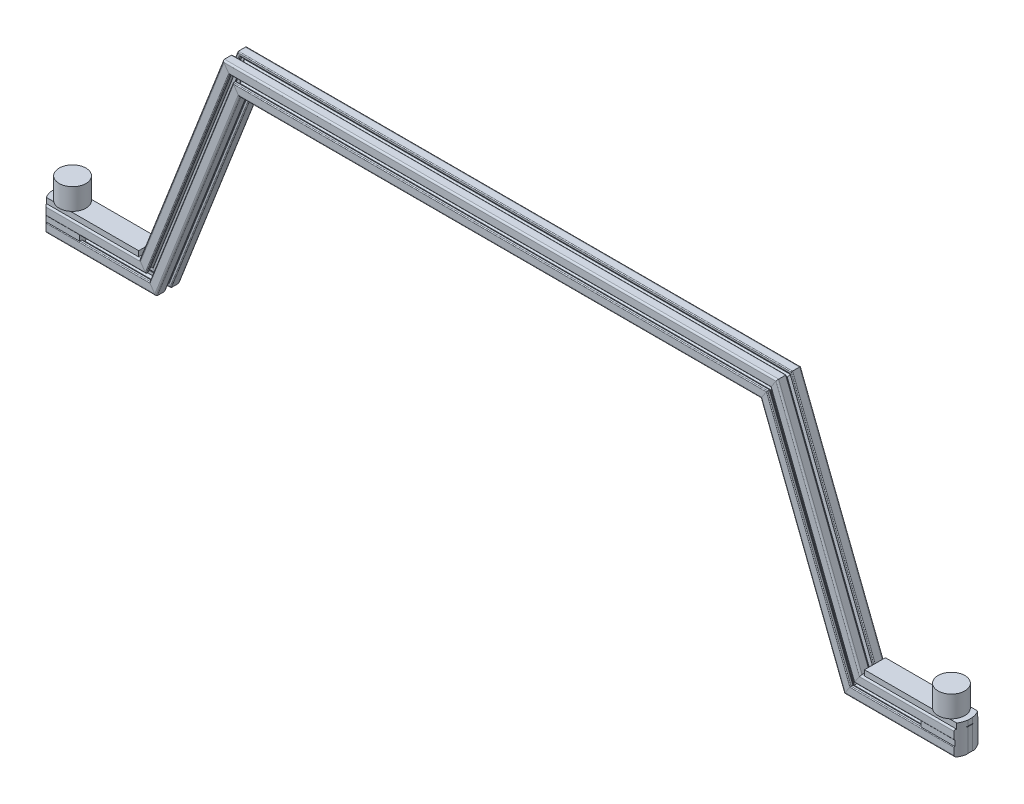
from build123d import *

# Parameters (mm, degrees)
SKETCH3_W            = 177.95649801978897
SKETCH3_H            = 38.99999999999999
BOSS_EXTRUDE1_DEPTH  = 10
SKETCH4_R            = 25.000000000000004
FL_WHEEL_MOUNT_DEPTH = 40
BOSS_EXTRUDE3_DEPTH  = 70
CUT_EXTRUDE1_REACH   = 943.011


with BuildPart() as part:
    # Sweep1: sweep along a path in Sketch1
    with BuildLine(Plane.XY) as sweep1_path:
        Line((0, 0), (200, 0))
        Line((200, 0), (355.8974358974359, 400))
        Line((355.8974358974359, 400), (855.8974358974358, 400))
    # Sketch7 → Sweep1 (sweep)
    with BuildSketch(Plane(origin=(0, 0, 0), x_dir=(0, 0, -1), z_dir=(1, 0, 0))):
        with BuildLine():
            Line((4.905816029016867, 11.21531925961758), (4.005816102684597, 10.70017121598502))
            Line((4.005816102684597, 10.70017121598502), (3.105816176352211, 11.21531925961758))
            Line((3.105816176352211, 11.21531925961758), (-2.1975082146962652, 11.215319259617562))
            ThreePointArc((-2.1975082146962652, 11.215319259617562), (-2.3429279189949894, 11.244245037263257), (-2.4662087915471362, 11.326618682766647))
            Line((-2.4662087915471362, 11.326618682766647), (-5.932884474166096, 14.79329436538555))
            ThreePointArc((-5.932884474166096, 14.79329436538555), (-6.015258119669531, 14.9165752379377), (-6.044183897315248, 15.06199494223645))
            Line((-6.044183897315248, 15.06199494223645), (-6.044183897315358, 19.35531925961757))
            ThreePointArc((-6.044183897315358, 19.35531925961757), (-5.93288447416625, 19.62401983646846), (-5.664183897315362, 19.73531925961757))
            Line((-5.664183897315362, 19.73531925961757), (-2.5791838973153265, 19.73531925961757))
            ThreePointArc((-2.5791838973153265, 19.73531925961757), (-1.5043815899117716, 20.180516952214003), (-1.0591838973153256, 21.25531925961755))
            Line((-1.0591838973153256, 21.25531925961755), (-1.059183897315572, 24.21531925961759))
            ThreePointArc((-1.059183897315572, 24.21531925961759), (-1.504381589912015, 25.290121567021124), (-2.579183897315554, 25.73531925961756))
            Line((-2.579183897315554, 25.73531925961756), (-15.4941838973154, 25.73531925961757))
            ThreePointArc((-15.4941838973154, 25.73531925961757), (-17.61550424087504, 24.85663960317721), (-18.4941838973154, 22.735319259617572))
            Line((-18.4941838973154, 22.735319259617572), (-18.4941838973154, 9.820319259617662))
            ThreePointArc((-18.4941838973154, 9.820319259617662), (-18.048986204718968, 8.745516952214107), (-16.97418389731542, 8.300319259617662))
            Line((-16.97418389731542, 8.300319259617662), (-14.014183897315382, 8.300319259617766))
            ThreePointArc((-14.014183897315382, 8.300319259617766), (-12.939381589911845, 8.745516952214206), (-12.494183897315379, 9.820319259617733))
            Line((-12.494183897315379, 9.820319259617733), (-12.4941838973154, 12.90531925961758))
            ThreePointArc((-12.4941838973154, 12.90531925961758), (-12.382884474166298, 13.17401983646847), (-12.11418389731541, 13.285319259617582))
            Line((-12.11418389731541, 13.285319259617582), (-7.81378851212248, 13.28531925961746))
            ThreePointArc((-7.81378851212248, 13.28531925961746), (-7.668368807823728, 13.256393481971749), (-7.545087935271565, 13.17401983646833))
            Line((-7.545087935271565, 13.17401983646833), (-4.08548332046457, 9.714415221661511))
            ThreePointArc((-4.08548332046457, 9.714415221661511), (-4.003109674961121, 9.591134349109351), (-3.974183897315418, 9.445714644810582))
            Line((-3.974183897315418, 9.445714644810582), (-3.9741838973154215, 4.135318894911249))
            Line((-3.9741838973154215, 4.135318894911249), (-3.454570627598921, 3.235319259617511))
            Line((-3.454570627598921, 3.235319259617511), (-3.9741838973154215, 2.335319624323374))
            Line((-3.9741838973154215, 2.335319624323374), (-3.9741838973154215, -2.968005057763236))
            ThreePointArc((-3.9741838973154215, -2.968005057763236), (-4.003109674961133, -3.1134247620619817), (-4.0854833204645455, -3.236705634614141))
            Line((-4.0854833204645455, -3.236705634614141), (-7.55215900308344, -6.703381317233124))
            ThreePointArc((-7.55215900308344, -6.703381317233124), (-7.675439875635574, -6.785754962736517), (-7.820859579934288, -6.81468074038222))
            Line((-7.820859579934288, -6.81468074038222), (-12.11418389731541, -6.814680740382358))
            ThreePointArc((-12.11418389731541, -6.814680740382358), (-12.382884474166277, -6.703381317233245), (-12.494183897315413, -6.4346807403823885))
            Line((-12.494183897315413, -6.4346807403823885), (-12.4941838973154, -3.349680740382297))
            ThreePointArc((-12.4941838973154, -3.349680740382297), (-12.939381589911832, -2.274878432978741), (-14.014183897315382, -1.8296807403822957))
            Line((-14.014183897315382, -1.8296807403822957), (-16.97418389731542, -1.829680740382543))
            ThreePointArc((-16.97418389731542, -1.829680740382543), (-18.04898620471899, -2.2748784329789906), (-18.49418389731542, -3.349680740382567))
            Line((-18.49418389731542, -3.349680740382567), (-18.4941838973154, -16.26468074038243))
            ThreePointArc((-18.4941838973154, -16.26468074038243), (-17.615504240875044, -18.386001083942077), (-15.4941838973154, -19.264680740382435))
            Line((-15.4941838973154, -19.264680740382435), (-2.57918389731544, -19.26468074038243))
            ThreePointArc((-2.57918389731544, -19.26468074038243), (-1.5043815899118904, -18.819483047785972), (-1.059183897315442, -17.74468074038242))
            Line((-1.059183897315442, -17.74468074038242), (-1.059183897315572, -14.78468074038241))
            ThreePointArc((-1.059183897315572, -14.78468074038241), (-1.5043815899120052, -13.709878432978856), (-2.579183897315554, -13.264680740382412))
            Line((-2.579183897315554, -13.264680740382412), (-5.664183897315362, -13.26468074038243))
            ThreePointArc((-5.664183897315362, -13.26468074038243), (-5.932884474166251, -13.15338131723332), (-6.044183897315363, -12.884680740382432))
            Line((-6.044183897315363, -12.884680740382432), (-6.044183897315244, -8.58428535518951))
            ThreePointArc((-6.044183897315244, -8.58428535518951), (-6.015258119669534, -8.438865650890763), (-5.932884474166121, -8.315584778338604))
            Line((-5.932884474166121, -8.315584778338604), (-2.473279859359261, -4.85598016353157))
            ThreePointArc((-2.473279859359261, -4.85598016353157), (-2.3499989868071354, -4.77360651802815), (-2.204579282508414, -4.744680740382445))
            Line((-2.204579282508414, -4.744680740382445), (3.105816176352211, -4.74468074038245))
            Line((3.105816176352211, -4.74468074038245), (4.005816102684597, -4.229532696749942))
            Line((4.005816102684597, -4.229532696749942), (4.9058160290169806, -4.74468074038245))
            Line((4.9058160290169806, -4.74468074038245), (10.20914042006546, -4.744680740382422))
            ThreePointArc((10.20914042006546, -4.744680740382422), (10.354560124364177, -4.773606518028121), (10.47784099691632, -4.855980163531502))
            Line((10.47784099691632, -4.855980163531502), (13.944516679535292, -8.322655846150411))
            ThreePointArc((13.944516679535292, -8.322655846150411), (14.02689032503872, -8.445936718702562), (14.05581610268444, -8.591356423001304))
            Line((14.05581610268444, -8.591356423001304), (14.05581610268455, -12.884680740382432))
            ThreePointArc((14.05581610268455, -12.884680740382432), (13.944516679535438, -13.153381317233318), (13.67581610268455, -13.26468074038243))
            Line((13.67581610268455, -13.26468074038243), (10.59081610268452, -13.26468074038243))
            ThreePointArc((10.59081610268452, -13.26468074038243), (9.516013795280966, -13.70987843297886), (9.070816102684521, -14.78468074038241))
            Line((9.070816102684521, -14.78468074038241), (9.070816102684764, -17.74468074038245))
            ThreePointArc((9.070816102684764, -17.74468074038245), (9.5160137952812, -18.819483047785987), (10.59081610268474, -19.264680740382424))
            Line((10.59081610268474, -19.264680740382424), (23.50581610268459, -19.26468074038243))
            ThreePointArc((23.50581610268459, -19.26468074038243), (25.627136446244233, -18.386001083942073), (26.50581610268459, -16.26468074038243))
            Line((26.50581610268459, -16.26468074038243), (26.50581610268448, -3.349680740382411))
            ThreePointArc((26.50581610268448, -3.349680740382411), (26.060618410088097, -2.2748784329789036), (24.985816102684634, -1.8296807403824098))
            Line((24.985816102684634, -1.8296807403824098), (22.02581610268446, -1.829680740382515))
            ThreePointArc((22.02581610268446, -1.829680740382515), (20.951013795280893, -2.2748784329789853), (20.50581610268446, -3.349680740382567))
            Line((20.50581610268446, -3.349680740382567), (20.50581610268448, -6.434680740382334))
            ThreePointArc((20.50581610268448, -6.434680740382334), (20.394516679535418, -6.703381317233182), (20.125816102684606, -6.814680740382337))
            Line((20.125816102684606, -6.814680740382337), (15.825420717491562, -6.814680740382217))
            ThreePointArc((15.825420717491562, -6.814680740382217), (15.680001013192856, -6.7857549627365215), (15.556720140640715, -6.703381317233152))
            Line((15.556720140640715, -6.703381317233152), (12.09711552583365, -3.24377670242626))
            ThreePointArc((12.09711552583365, -3.24377670242626), (12.014741880330227, -3.120495829874147), (11.985816102684492, -2.975076125575442))
            Line((11.985816102684492, -2.975076125575442), (11.9858161026845, 2.335319624323545))
            Line((11.9858161026845, 2.335319624323545), (11.46620283296811, 3.235319259617624))
            Line((11.46620283296811, 3.235319259617624), (11.98581610268461, 4.135318894911704))
            Line((11.98581610268461, 4.135318894911704), (11.98581610268461, 9.438643576998516))
            ThreePointArc((11.98581610268461, 9.438643576998516), (12.014741880330329, 9.584063281297267), (12.097115525833749, 9.70734415384943))
            Line((12.097115525833749, 9.70734415384943), (15.563791208452631, 13.174019836468371))
            ThreePointArc((15.563791208452631, 13.174019836468371), (15.687072081004764, 13.256393481971767), (15.832491785303478, 13.28531925961747))
            Line((15.832491785303478, 13.28531925961747), (20.1258161026846, 13.28531925961761))
            ThreePointArc((20.1258161026846, 13.28531925961761), (20.394516679535503, 13.174019836468457), (20.5058161026846, 12.905319259617526))
            Line((20.5058161026846, 12.905319259617526), (20.50581610268459, 9.820319259617548))
            ThreePointArc((20.50581610268459, 9.820319259617548), (20.951013795281032, 8.745516952213997), (22.02581610268458, 8.300319259617549))
            Line((22.02581610268458, 8.300319259617549), (24.98581610268461, 8.300319259617792))
            ThreePointArc((24.98581610268461, 8.300319259617792), (26.06061841008815, 8.74551695221421), (26.50581610268461, 9.820319259617733))
            Line((26.50581610268461, 9.820319259617733), (26.5058161026846, 22.735319259617572))
            ThreePointArc((26.5058161026846, 22.735319259617572), (25.627136446244233, 24.85663960317721), (23.50581610268459, 25.73531925961757))
            Line((23.50581610268459, 25.73531925961757), (10.59081610268463, 25.73531925961757))
            ThreePointArc((10.59081610268463, 25.73531925961757), (9.51601379528108, 25.29012156702114), (9.070816102684635, 24.21531925961759))
            Line((9.070816102684635, 24.21531925961759), (9.070816102684764, 21.25531925961758))
            ThreePointArc((9.070816102684764, 21.25531925961758), (9.51601379528119, 20.18051695221402), (10.59081610268474, 19.735319259617576))
            Line((10.59081610268474, 19.735319259617576), (13.67581610268455, 19.73531925961757))
            ThreePointArc((13.67581610268455, 19.73531925961757), (13.944516679535438, 19.624019836468456), (14.055816102684554, 19.35531925961757))
            Line((14.055816102684554, 19.35531925961757), (14.055816102684432, 15.05492387442464))
            ThreePointArc((14.055816102684432, 15.05492387442464), (14.026890325038721, 14.909504170125889), (13.944516679535301, 14.786223297573725))
            Line((13.944516679535301, 14.786223297573725), (10.484912064728451, 11.326618682766702))
            ThreePointArc((10.484912064728451, 11.326618682766702), (10.361631192176315, 11.244245037263312), (10.2162114878776, 11.215319259617608))
            Line((10.2162114878776, 11.215319259617608), (4.905816029016867, 11.21531925961758))
        make_face()
        with BuildLine():
            Line((13.969837884314126, 21.274341041247055), (13.529837884314462, 21.274341041247))
            ThreePointArc((13.529837884314462, 21.274341041247), (12.46917771253464, 21.713680869467176), (12.02983788431446, 22.774341041247))
            Line((12.02983788431446, 22.774341041247), (12.02983788431446, 23.27434104124714))
            ThreePointArc((12.02983788431446, 23.27434104124714), (12.469177712534641, 24.335001213026963), (13.529837884314462, 24.77434104124714))
            Line((13.529837884314462, 24.77434104124714), (23.1398378843142, 24.77434104124711))
            ThreePointArc((23.1398378843142, 24.77434104124711), (24.752041345419528, 24.10654450235244), (25.4198378843142, 22.49434104124711))
            Line((25.4198378843142, 22.49434104124711), (25.41983788431417, 12.8843410412473))
            ThreePointArc((25.41983788431417, 12.8843410412473), (24.98049805609399, 11.823680869467479), (23.91983788431417, 11.384341041247298))
            Line((23.91983788431417, 11.384341041247298), (23.41983788431416, 11.38434104124724))
            ThreePointArc((23.41983788431416, 11.38434104124724), (22.359177712534358, 11.823680869467406), (21.919837884314166, 12.884341041247197))
            Line((21.919837884314166, 12.884341041247197), (21.919837884314173, 13.32434104124721))
            ThreePointArc((21.919837884314173, 13.32434104124721), (21.62694466550073, 14.031447822433739), (20.919837884314216, 14.32434104124721))
            Line((20.919837884314216, 14.32434104124721), (15.34983788431423, 14.324341041247353))
            ThreePointArc((15.34983788431423, 14.324341041247353), (15.08113730746334, 14.435640464396453), (14.969837884314229, 14.70434104124734))
            Line((14.969837884314229, 14.70434104124734), (14.96983788431424, 20.27434104124706))
            ThreePointArc((14.96983788431424, 20.27434104124706), (14.676944665500747, 20.981447822433648), (13.969837884314126, 21.274341041247055))
        make_face(mode=Mode.SUBTRACT)
        with BuildLine():
            Line((21.95885966594362, -6.689680740382415), (21.95885966594362, -6.249680740382729))
            ThreePointArc((21.95885966594362, -6.249680740382729), (22.398199494163798, -5.189020568602908), (23.45885966594362, -4.74968074038273))
            Line((23.45885966594362, -4.74968074038273), (23.958859665943745, -4.749680740382729))
            ThreePointArc((23.958859665943745, -4.749680740382729), (25.01951983772356, -5.189020568602912), (25.458859665943738, -6.249680740382729))
            Line((25.458859665943738, -6.249680740382729), (25.45885966594368, -15.859680740382462))
            ThreePointArc((25.45885966594368, -15.859680740382462), (24.791063127048982, -17.471884201487782), (23.17885966594365, -18.13968074038246))
            Line((23.17885966594365, -18.13968074038246), (13.56885966594387, -18.13968074038243))
            ThreePointArc((13.56885966594387, -18.13968074038243), (12.50819949416405, -17.70034091216225), (12.068859665943872, -16.63968074038243))
            Line((12.068859665943872, -16.63968074038243), (12.06885966594381, -16.13968074038244))
            ThreePointArc((12.06885966594381, -16.13968074038244), (12.508199494163975, -15.079020568602633), (13.568859665943767, -14.63968074038244))
            Line((13.568859665943767, -14.63968074038244), (14.008859665943811, -14.63968074038243))
            ThreePointArc((14.008859665943811, -14.63968074038243), (14.715966447130349, -14.346787521568986), (15.008859665943808, -13.639680740382458))
            Line((15.008859665943808, -13.639680740382458), (15.00885966594392, -8.069680740382497))
            ThreePointArc((15.00885966594392, -8.069680740382497), (15.120159089093024, -7.800980163531606), (15.38885966594391, -7.689680740382494))
            Line((15.38885966594391, -7.689680740382494), (20.95885966594362, -7.6896807403825))
            ThreePointArc((20.95885966594362, -7.6896807403825), (21.6659664471302, -7.396787521569017), (21.95885966594362, -6.689680740382415))
        make_face(mode=Mode.SUBTRACT)
        with BuildLine():
            Line((-6.005162115685757, -14.678702522011942), (-5.565162115686073, -14.67870252201189))
            ThreePointArc((-5.565162115686073, -14.67870252201189), (-4.504501943906252, -15.118042350232068), (-4.065162115686071, -16.17870252201189))
            Line((-4.065162115686071, -16.17870252201189), (-4.065162115686073, -16.67870252201203))
            ThreePointArc((-4.065162115686073, -16.67870252201203), (-4.504501943906252, -17.739362693791854), (-5.565162115686073, -18.17870252201203))
            Line((-5.565162115686073, -18.17870252201203), (-15.175162115685803, -18.178702522012))
            ThreePointArc((-15.175162115685803, -18.178702522012), (-16.787365576791128, -17.510905983117325), (-17.4551621156858, -15.898702522012))
            Line((-17.4551621156858, -15.898702522012), (-17.4551621156858, -6.288702522012187))
            ThreePointArc((-17.4551621156858, -6.288702522012187), (-17.01582228746562, -5.228042350232365), (-15.9551621156858, -4.788702522012187))
            Line((-15.9551621156858, -4.788702522012187), (-15.45516211568583, -4.788702522012131))
            ThreePointArc((-15.45516211568583, -4.788702522012131), (-14.394501943906025, -5.228042350232296), (-13.95516211568583, -6.2887025220120885))
            Line((-13.95516211568583, -6.2887025220120885), (-13.9551621156858, -6.7287025220121))
            ThreePointArc((-13.9551621156858, -6.7287025220121), (-13.662268896872359, -7.4358093031986385), (-12.955162115685829, -7.728702522012101))
            Line((-12.955162115685829, -7.728702522012101), (-7.385162115685895, -7.7287025220122425))
            ThreePointArc((-7.385162115685895, -7.7287025220122425), (-7.116461538835007, -7.84000194516135), (-7.005162115685896, -8.108702522012237))
            Line((-7.005162115685896, -8.108702522012237), (-7.005162115685843, -13.67870252201194))
            ThreePointArc((-7.005162115685843, -13.67870252201194), (-6.71226889687236, -14.385809303198519), (-6.005162115685757, -14.678702522011942))
        make_face(mode=Mode.SUBTRACT)
        with BuildLine():
            Line((1.828915921783154, -2.488564033794063), (1.413170132153103, -2.3163564892297765))
            ThreePointArc((1.413170132153103, -2.3163564892297765), (0.8233361546720646, -1.6253071256103948), (1.0362699251979821, -0.7420673205067814))
            ThreePointArc((1.0362699251979821, -0.7420673205067814), (0.44670320424367826, -0.23761386930494943), (-0.05771663654724213, 0.351981608207141))
            ThreePointArc((-0.05771663654724213, 0.351981608207141), (-0.9409371706461417, 0.13910189708009613), (-1.6319522534634663, 0.7289276667633529))
            Line((-1.6319522534634663, 0.7289276667633529), (-1.8041597980277773, 1.144673456393433))
            ThreePointArc((-1.8041597980277773, 1.144673456393433), (-1.7325897121288976, 2.0503947527944133), (-0.957477943443773, 2.5243726953145917))
            ThreePointArc((-0.957477943443773, 2.5243726953145917), (-1.0176621136546347, 3.2979617778010164), (-0.9574338433371404, 4.071547428094972))
            ThreePointArc((-0.9574338433371404, 4.071547428094972), (-1.7324937595966465, 4.545549969724606), (-1.804045409097357, 5.451241222148561))
            Line((-1.804045409097357, 5.451241222148561), (-1.6318378645330658, 5.866987011778611))
            ThreePointArc((-1.6318378645330658, 5.866987011778611), (-0.940788500913663, 6.456820989259641), (-0.05754869581003179, 6.243887218733747))
            ThreePointArc((-0.05754869581003179, 6.243887218733747), (0.4469047553918468, 6.833453939687905), (1.0365002329039577, 7.337873780478677))
            ThreePointArc((1.0365002329039577, 7.337873780478677), (0.8236205217769148, 8.221094314577591), (1.4134462914601942, 8.912109397394914))
            Line((1.4134462914601942, 8.912109397394914), (1.8291920810902504, 9.084316941959186))
            ThreePointArc((1.8291920810902504, 9.084316941959186), (2.734913377491232, 9.012746856060335), (3.208891320011409, 8.23763508737521))
            ThreePointArc((3.208891320011409, 8.23763508737521), (3.982480402497697, 8.297819257585996), (4.7560660527915095, 8.237590987268506))
            ThreePointArc((4.7560660527915095, 8.237590987268506), (5.230068594421157, 9.01265090352799), (6.135759846845102, 9.084202553028694))
            Line((6.135759846845102, 9.084202553028694), (6.551505636475179, 8.911995008464404))
            ThreePointArc((6.551505636475179, 8.911995008464404), (7.141339613955897, 8.220945644845237), (6.928405843430371, 7.337705839741907))
            ThreePointArc((6.928405843430371, 7.337705839741907), (7.517972564384662, 6.83325238854008), (8.022392405175577, 6.243656911027995))
            ThreePointArc((8.022392405175577, 6.243656911027995), (8.90561293927449, 6.456536622155043), (9.59662802209183, 5.866710852471783))
            Line((9.59662802209183, 5.866710852471783), (9.768835566656085, 5.450965062841702))
            ThreePointArc((9.768835566656085, 5.450965062841702), (9.697265480757252, 4.545243766440708), (8.922153712072108, 4.071265823920541))
            ThreePointArc((8.922153712072108, 4.071265823920541), (8.982337882282934, 3.2976767414341053), (8.922109611965613, 2.5240910911401406))
            ThreePointArc((8.922109611965613, 2.5240910911401406), (9.697169528224983, 2.050088549510487), (9.76872117772571, 1.1443972970866416))
            Line((9.76872117772571, 1.1443972970866416), (9.596513633161447, 0.7286515074565642))
            ThreePointArc((9.596513633161447, 0.7286515074565642), (8.905464269542016, 0.13881752997559105), (8.022224464438398, 0.3517513005014714))
            ThreePointArc((8.022224464438398, 0.3517513005014714), (7.517771013236633, -0.23781542045279824), (6.928175535724686, -0.7422352612437741))
            ThreePointArc((6.928175535724686, -0.7422352612437741), (7.14105524685153, -1.6254557953426318), (6.551229477168359, -2.3164708781599113))
            Line((6.551229477168359, -2.3164708781599113), (6.1354836875382786, -2.4886784227241967))
            ThreePointArc((6.1354836875382786, -2.4886784227241967), (5.229762391137301, -2.4171083368253283), (4.755784448617146, -1.641996568140192))
            ThreePointArc((4.755784448617146, -1.641996568140192), (3.982195366130722, -1.7021807383512026), (3.2086097158367415, -1.6419524680338808))
            ThreePointArc((3.2086097158367415, -1.6419524680338808), (2.734607174207096, -2.4170123842933635), (1.828915921783154, -2.488564033794063))
        make_face(mode=Mode.SUBTRACT)
        with BuildLine():
            Line((-13.99418389731535, 13.285319259617525), (-13.99418389731529, 12.84531925961784))
            ThreePointArc((-13.99418389731529, 12.84531925961784), (-14.43352372553547, 11.784659087838019), (-15.49418389731529, 11.34531925961784))
            Line((-15.49418389731529, 11.34531925961784), (-15.994183897315432, 11.34531925961784))
            ThreePointArc((-15.994183897315432, 11.34531925961784), (-17.05484406909525, 11.78465908783802), (-17.49418389731543, 12.84531925961784))
            Line((-17.49418389731543, 12.84531925961784), (-17.4941838973154, 22.45531925961757))
            ThreePointArc((-17.4941838973154, 22.45531925961757), (-16.826387358420728, 24.0675227207229), (-15.2141838973154, 24.735319259617572))
            Line((-15.2141838973154, 24.735319259617572), (-5.604183897315587, 24.73531925961757))
            ThreePointArc((-5.604183897315587, 24.73531925961757), (-4.543523725535764, 24.29597943139739), (-4.104183897315586, 23.23531925961757))
            Line((-4.104183897315586, 23.23531925961757), (-4.104183897315531, 22.735319259617572))
            ThreePointArc((-4.104183897315531, 22.735319259617572), (-4.543523725535693, 21.674659087837767), (-5.604183897315486, 21.235319259617572))
            Line((-5.604183897315486, 21.235319259617572), (-6.0441838973155, 21.23531925961757))
            ThreePointArc((-6.0441838973155, 21.23531925961757), (-6.751290678502038, 20.942426040804126), (-7.0441838973155, 20.235319259617597))
            Line((-7.0441838973155, 20.235319259617597), (-7.044183897315642, 14.66531925961763))
            ThreePointArc((-7.044183897315642, 14.66531925961763), (-7.155483320464751, 14.396618682766743), (-7.424183897315638, 14.28531925961763))
            Line((-7.424183897315638, 14.28531925961763), (-12.99418389731535, 14.28531925961758))
            ThreePointArc((-12.99418389731535, 14.28531925961758), (-13.701290678501918, 13.992426040804109), (-13.99418389731535, 13.285319259617525))
        make_face(mode=Mode.SUBTRACT)
    sweep1 = sweep(path=sweep1_path.line, transition=Transition.RIGHT)

    # Sketch3 → Boss-Extrude1 (add)
    with BuildSketch(Plane(origin=(0, 25.73531925961756, -1.383e-14), x_dir=(1, 0, 0), z_dir=(0, 1, -5.4e-16))):
        with Locations((88.97824900989448, 4.005816102684581)):
            Rectangle(SKETCH3_W, SKETCH3_H)
    boss_extrude1 = extrude(amount=BOSS_EXTRUDE1_DEPTH)

    # Sketch4 → FL Wheel Mount (add)
    with BuildSketch(Plane(origin=(0, 35.73531925961756, -1.907e-14), x_dir=(1, 0, 0), z_dir=(0, 1, 1.702e-14))):
        with Locations(Location((35, 4.005816102684582, 0), (0, 0, 51.260575402))):
            Circle(SKETCH4_R)
    fl_wheel_mount = extrude(amount=FL_WHEEL_MOUNT_DEPTH)

    # Sketch6 → Boss-Extrude3 (add)
    with BuildSketch(Plane.ZY):
        Polygon((-25.627136446244275, 24.856639603177168), (17.61550424087506, 24.85663960317721), (17.61550424087506, -18.38600108394207), (-25.627136446244272, -18.38600108394215), align=None)
    boss_extrude3 = extrude(amount=-BOSS_EXTRUDE3_DEPTH)

    # Cut-Extrude1: up to this face of the body (flat: up to its plane)
    cut_extrude1_end = Plane(part.part.faces().sort_by_distance((106.58392122, -19.26468074, 9.036683897))[0])
    # Sketch5 → Cut-Extrude1 (cut, up to the picked face)
    with BuildSketch(Plane(origin=(0, 35.73531925961756, -1.907e-14), x_dir=(1, 0, 0), z_dir=(0, 1, 1.702e-14)), mode=Mode.PRIVATE) as cut_extrude1_sk1:
        with BuildLine():
            Line((35, -31.22267467748556), (35.00000000000001, -74.8110137153759))
            Line((35.00000000000001, -74.8110137153759), (-61.224063346656976, -74.8110137153759))
            Line((-61.224063346656976, -74.8110137153759), (-61.224063346656976, 58.49210550464079))
            Line((-61.224063346656976, 58.49210550464079), (35.00000000000001, 58.49210550464079))
            Line((35.00000000000001, 58.49210550464079), (35, 39.23430688285472))
            ThreePointArc((35, 39.23430688285472), (-0.2284907801701337, 4.005816102684586), (35, -31.22267467748556))
        make_face()
    cut_extrude1_tool1 = split(extrude(cut_extrude1_sk1.sketch, amount=-CUT_EXTRUDE1_REACH, mode=Mode.PRIVATE), bisect_by=cut_extrude1_end, keep=Keep.BOTH, mode=Mode.PRIVATE)
    cut_extrude1 = cut_extrude1_tool1.solids().sort_by(Axis((-19.05495, 35.735319, 10.339668), (0, -1, -1.702e-14)))[0]
    add(cut_extrude1, mode=Mode.SUBTRACT)

    # Mirror1: Sweep1, Boss-Extrude1, FL Wheel Mount, Boss-Extrude3, Cut-Extrude1 across plane
    add(sweep1.mirror(Plane(origin=(855.8974358974356, 0, 0), x_dir=(0, 0, 1), z_dir=(1, 0, 0))))
    add(boss_extrude1.mirror(Plane(origin=(855.8974358974356, 0, 0), x_dir=(0, 0, 1), z_dir=(1, 0, 0))))
    add(fl_wheel_mount.mirror(Plane(origin=(855.8974358974356, 0, 0), x_dir=(0, 0, 1), z_dir=(1, 0, 0))))
    add(boss_extrude3.mirror(Plane(origin=(855.8974358974356, 0, 0), x_dir=(0, 0, 1), z_dir=(1, 0, 0))))
    add(cut_extrude1.mirror(Plane(origin=(855.8974358974356, 0, 0), x_dir=(0, 0, 1), z_dir=(1, 0, 0))), mode=Mode.SUBTRACT)


solid = part.part
